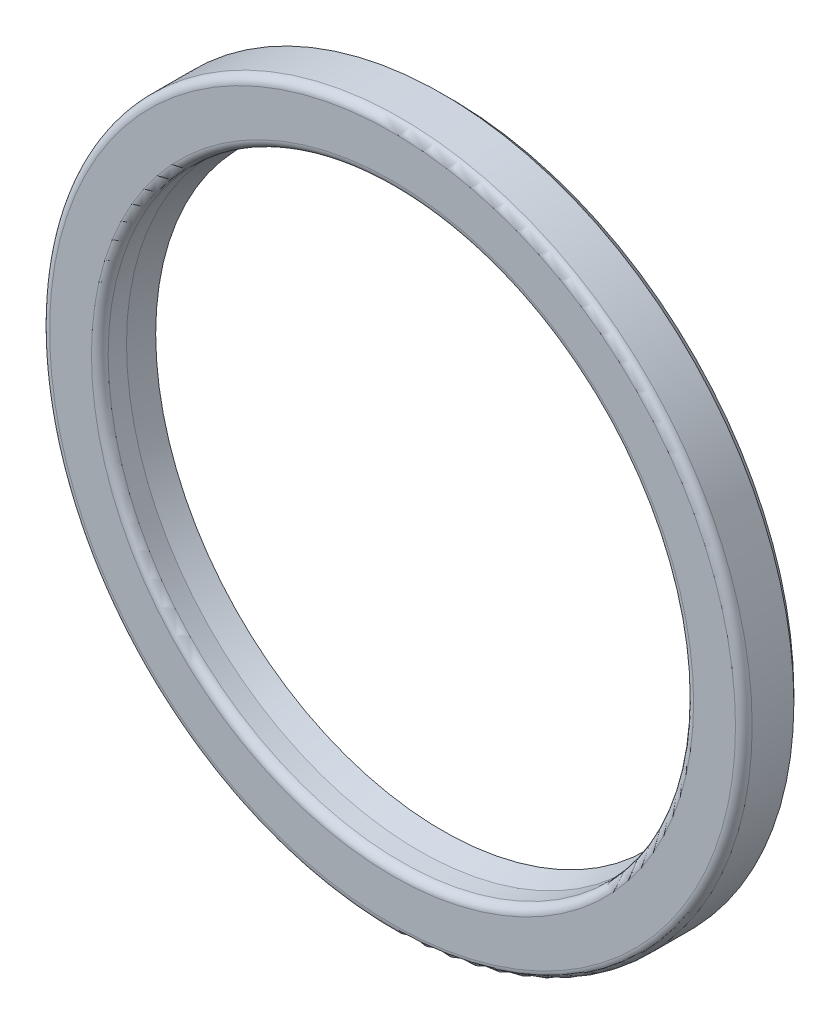
from build123d import *


with BuildPart() as part:
    # Sketch1 → Revolve1 (revolve)
    with BuildSketch(Plane(origin=(0, 0, 0), x_dir=(0, 0, -1), z_dir=(1, 0, 0))):
        with BuildLine():
            Line((0, 18.05), (0, 20.56))
            ThreePointArc((0, 20.56), (0.146446609, 20.913553391), (0.5, 21.06))
            Line((0.5, 21.06), (3, 21.06))
            Line((3, 21.06), (3.5, 20.56))
            Line((3.5, 20.56), (3.5, 20.4))
            Line((3.5, 20.4), (0.5, 20.4))
            Line((0.5, 20.4), (0.5, 19.4))
            Line((0.5, 19.4), (3.5, 18.3))
            Line((3.5, 18.3), (3.5, 18))
            Line((3.5, 18), (3, 17.2))
            Line((3, 17.2), (1.6, 17.55))
            Line((1.6, 17.55), (0.5, 17.55))
            ThreePointArc((0.5, 17.55), (0.146446609, 17.696446609), (0, 18.05))
        make_face()
    revolve(axis=Axis((0, 0, 0), (0, 0, -1)))


solid = part.part
